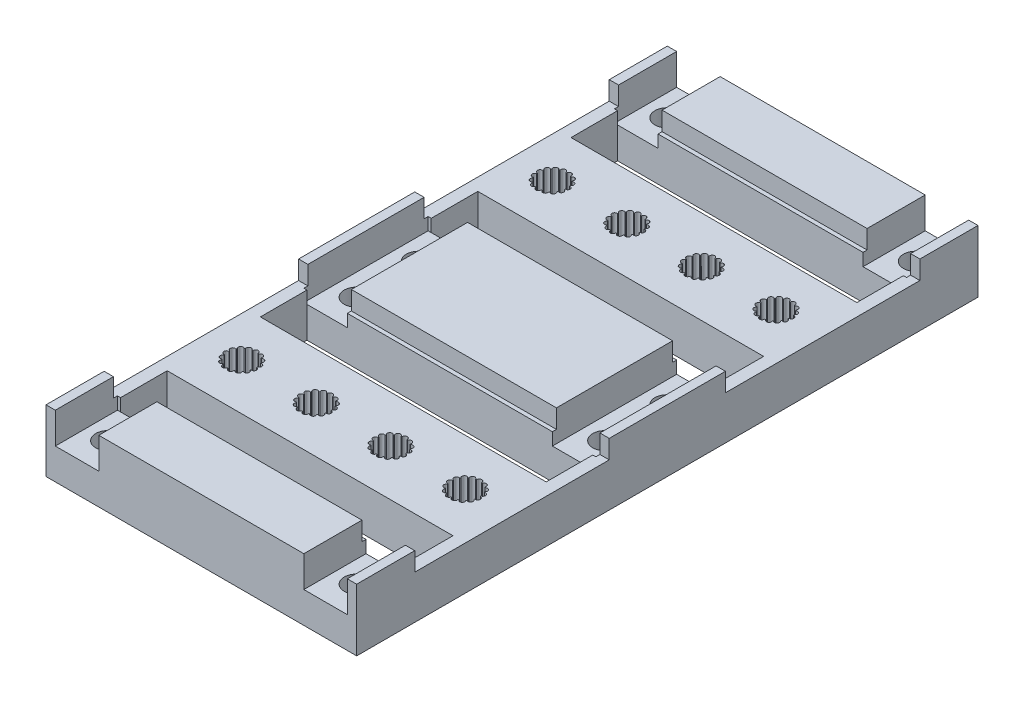
from build123d import *

# Parameters (mm, degrees)
SKETCH1_W                                  = 50
SKETCH1_H                                  = 50
BOSS_EXTRUDE2_DEPTH                        = 10
SKETCH2_W                                  = 50
SKETCH2_H                                  = 31.3
SKETCH2_W_2                                = 4.65
CUT_EXTRUDE1_DEPTH                         = 3
SKETCH3_R                                  = 2
CUT_EXTRUDE2_DEPTH                         = 34
SKETCH4_W                                  = 7
SKETCH4_H                                  = 10
CUT_EXTRUDE4_DEPTH                         = 5
MIRROR1_AT_THE_SECOND_PLANE_COPY_1_SKETC_W = 7
MIRROR1_AT_THE_SECOND_PLANE_COPY_1_SKETC_H = 10
MIRROR1_AT_THE_SECOND_PLANE_COPY_1_DEPTH   = 5
SKETCH6_W                                  = 46
SKETCH6_H                                  = 30
SKETCH6_W_2                                = 40
SKETCH6_H_2                                = 24
CUT_EXTRUDE5_DEPTH                         = 37.041642582
BOSS_EXTRUDE3_START                        = -10
BOSS_EXTRUDE3_OUTLINE_W                    = 46
BOSS_EXTRUDE3_OUTLINE_H                    = 15
BOSS_EXTRUDE3_DEPTH                        = 7


# Read off the part's stored shape, not the designer's step: Boss-Extrude3
with BuildPart() as part:
    # Sketch1 → Boss-Extrude2 (new body)
    with BuildSketch(Plane(origin=(0, 0, 0), x_dir=(1, 0, 0), z_dir=(0, 1, 0))):
        Rectangle(SKETCH1_W, SKETCH1_H)
    extrude(amount=BOSS_EXTRUDE2_DEPTH)

    # Sketch2 → Cut-Extrude1 (cut)
    with BuildSketch(Plane(origin=(0, 10, 0), x_dir=(1, 0, 0), z_dir=(0, 1, 0))):
        Rectangle(SKETCH2_W, SKETCH2_H)
        with Locations((-27.325, 0)):
            Rectangle(SKETCH2_W_2, SKETCH2_H)
        with Locations((27.325, 0)):
            Rectangle(SKETCH2_W_2, SKETCH2_H)
    extrude(amount=-CUT_EXTRUDE1_DEPTH, mode=Mode.SUBTRACT)

    # Sketch3 → Cut-Extrude2 (cut)
    with BuildSketch(Plane(origin=(0, 10, 0), x_dir=(1, 0, 0), z_dir=(0, 1, 0))):
        with Locations(Location((-20, 20, 0), (0, 0, 270))):
            Circle(SKETCH3_R)
        with Locations(Location((20, 20, 0), (0, 0, 270))):
            Circle(SKETCH3_R)
        with Locations(Location((20, -20, 0), (0, 0, 270))):
            Circle(SKETCH3_R)
        with Locations(Location((-20, -20, 0), (0, 0, 270))):
            Circle(SKETCH3_R)
    extrude(amount=-CUT_EXTRUDE2_DEPTH, mode=Mode.SUBTRACT)

    # Sketch4 → Cut-Extrude4 (cut)
    with BuildSketch(Plane(origin=(0, 10, 0), x_dir=(1, 0, 0), z_dir=(0, 1, 0))):
        with Locations((-20, 20)):
            Rectangle(SKETCH4_W, SKETCH4_H)
    cut_extrude4 = extrude(amount=-CUT_EXTRUDE4_DEPTH, mode=Mode.SUBTRACT)

    # Mirror1: Cut-Extrude4 across plane
    add(cut_extrude4.mirror(Plane.ZY), mode=Mode.SUBTRACT)

    # Mirror1 at the second plane: Cut-Extrude4 across plane
    add(cut_extrude4.mirror(Plane.XY), mode=Mode.SUBTRACT)

    # Mirror1 at the second plane copy 1 sketc → Mirror1 at the second plane copy 1 (cut)
    with BuildSketch(Plane(origin=(0, 10, 0), x_dir=(-1, 0, 0), z_dir=(0, 1, 0))):
        with Locations((-20, 20)):
            Rectangle(MIRROR1_AT_THE_SECOND_PLANE_COPY_1_SKETC_W, MIRROR1_AT_THE_SECOND_PLANE_COPY_1_SKETC_H)
    extrude(amount=-MIRROR1_AT_THE_SECOND_PLANE_COPY_1_DEPTH, mode=Mode.SUBTRACT)

    # Sketch6 → Cut-Extrude5 (cut, through all)
    # profile 1 of 2: a face of its own
    with BuildSketch(Plane(origin=(0, 7, 0), x_dir=(1, 0, 0), z_dir=(0, 1, 0))):
        Rectangle(SKETCH6_W, SKETCH6_H)
        Rectangle(SKETCH6_W_2, SKETCH6_H_2, mode=Mode.SUBTRACT)
    # profile 2 of 2: a face of its own
    with BuildSketch(Plane(origin=(0, 7, 0), x_dir=(1, 0, 0), z_dir=(0, 1, 0))):
        Rectangle(SKETCH6_W_2, SKETCH6_H_2)
    extrude(amount=-CUT_EXTRUDE5_DEPTH, mode=Mode.SUBTRACT)

    # Boss-Extrude3 outline → Boss-Extrude3 (add)
    with BuildSketch(Plane(origin=(0, 10, 0), x_dir=(1, 0, 0), z_dir=(0, 1, 0)).offset(BOSS_EXTRUDE3_START)):
        Rectangle(BOSS_EXTRUDE3_OUTLINE_W, BOSS_EXTRUDE3_OUTLINE_H)
        with BuildLine():
            ThreePointArc((-20.489629063, 1.063217688), (-20.455241909, 1.125), (-20.418930434, 1.185671305))
            ThreePointArc((-20.418930434, 1.185671305), (-20.476018538, 1.773196107), (-19.885744926, 1.777833803))
            ThreePointArc((-19.885744926, 1.777833803), (-19.829201567, 1.820288237), (-19.771352142, 1.860945025))
            ThreePointArc((-19.771352142, 1.860945025), (-19.584536854, 2.420895463), (-19.043408757, 2.185046302))
            ThreePointArc((-19.043408757, 2.185046302), (-18.974486054, 2.200832102), (-18.905101369, 2.214444444))
            ThreePointArc((-18.905101369, 2.214444444), (-18.50668475, 2.65), (-18.108268131, 2.214444444))
            ThreePointArc((-18.108268131, 2.214444444), (-18.038883446, 2.200832102), (-17.969960743, 2.185046302))
            ThreePointArc((-17.969960743, 2.185046302), (-17.428832646, 2.420895463), (-17.242017358, 1.860945025))
            ThreePointArc((-17.242017358, 1.860945025), (-17.184167933, 1.820288237), (-17.127624574, 1.777833803))
            ThreePointArc((-17.127624574, 1.777833803), (-16.537350963, 1.773196107), (-16.594439066, 1.185671305))
            ThreePointArc((-16.594439066, 1.185671305), (-16.558127592, 1.125), (-16.523740437, 1.063217688))
            ThreePointArc((-16.523740437, 1.063217688), (-15.986384982, 0.818895035), (-16.277505425, 0.305384245))
            ThreePointArc((-16.277505425, 0.305384245), (-16.269010486, 0.235189043), (-16.262725387, 0.164761577))
            ThreePointArc((-16.262725387, 0.164761577), (-15.871201727, -0.277000427), (-16.346017141, -0.627706526))
            ThreePointArc((-16.346017141, -0.627706526), (-16.366807588, -0.695288238), (-16.389711296, -0.762183309))
            ThreePointArc((-16.389711296, -0.762183309), (-16.21171743, -1.325000001), (-16.788127916, -1.452261136))
            ThreePointArc((-16.788127916, -1.452261136), (-16.834608893, -1.505543864), (-16.882741148, -1.557339776))
            ThreePointArc((-16.882741148, -1.557339776), (-16.949053832, -2.143895035), (-17.527392779, -2.025706602))
            ThreePointArc((-17.527392779, -2.025706602), (-17.591527303, -2.05547728), (-17.656565601, -2.083218047))
            ThreePointArc((-17.656565601, -2.083218047), (-17.955718769, -2.592091142), (-18.435986122, -2.248888993))
            ThreePointArc((-18.435986122, -2.248888993), (-18.50668475, -2.25), (-18.577383379, -2.248888993))
            ThreePointArc((-18.577383379, -2.248888993), (-19.057650731, -2.592091142), (-19.356803899, -2.083218047))
            ThreePointArc((-19.356803899, -2.083218047), (-19.421842197, -2.05547728), (-19.485976721, -2.025706602))
            ThreePointArc((-19.485976721, -2.025706602), (-20.064315669, -2.143895035), (-20.130628352, -1.557339776))
            ThreePointArc((-20.130628352, -1.557339776), (-20.178760607, -1.505543864), (-20.225241585, -1.452261136))
            ThreePointArc((-20.225241585, -1.452261136), (-20.80165207, -1.325), (-20.623658204, -0.762183309))
            ThreePointArc((-20.623658204, -0.762183309), (-20.646561912, -0.695288238), (-20.667352359, -0.627706526))
            ThreePointArc((-20.667352359, -0.627706526), (-21.142167773, -0.277000427), (-20.750644113, 0.164761577))
            ThreePointArc((-20.750644113, 0.164761577), (-20.744359015, 0.235189043), (-20.735864075, 0.305384245))
            ThreePointArc((-20.735864075, 0.305384245), (-21.026984518, 0.818895035), (-20.489629063, 1.063217688))
        make_face(mode=Mode.SUBTRACT)
        with BuildLine():
            ThreePointArc((-6.108268131, 2.214444444), (-6.038883446, 2.200832102), (-5.969960743, 2.185046302))
            ThreePointArc((-5.969960743, 2.185046302), (-5.428832646, 2.420895463), (-5.242017358, 1.860945025))
            ThreePointArc((-5.242017358, 1.860945025), (-5.184167933, 1.820288237), (-5.127624574, 1.777833803))
            ThreePointArc((-5.127624574, 1.777833803), (-4.537350963, 1.773196107), (-4.594439066, 1.185671305))
            ThreePointArc((-4.594439066, 1.185671305), (-4.558127592, 1.125), (-4.523740437, 1.063217688))
            ThreePointArc((-4.523740437, 1.063217688), (-3.986384982, 0.818895035), (-4.277505425, 0.305384245))
            ThreePointArc((-4.277505425, 0.305384245), (-4.269010486, 0.235189043), (-4.262725387, 0.164761577))
            ThreePointArc((-4.262725387, 0.164761577), (-3.871201727, -0.277000427), (-4.346017141, -0.627706526))
            ThreePointArc((-4.346017141, -0.627706526), (-4.366807588, -0.695288238), (-4.389711296, -0.762183309))
            ThreePointArc((-4.389711296, -0.762183309), (-4.21171743, -1.325000001), (-4.788127916, -1.452261136))
            ThreePointArc((-4.788127916, -1.452261136), (-4.834608893, -1.505543864), (-4.882741148, -1.557339776))
            ThreePointArc((-4.882741148, -1.557339776), (-4.949053832, -2.143895035), (-5.527392779, -2.025706602))
            ThreePointArc((-5.527392779, -2.025706602), (-5.591527303, -2.05547728), (-5.656565601, -2.083218047))
            ThreePointArc((-5.656565601, -2.083218047), (-5.955718769, -2.592091142), (-6.435986122, -2.248888993))
            ThreePointArc((-6.435986122, -2.248888993), (-6.50668475, -2.25), (-6.577383379, -2.248888993))
            ThreePointArc((-6.577383379, -2.248888993), (-7.057650731, -2.592091142), (-7.356803899, -2.083218047))
            ThreePointArc((-7.356803899, -2.083218047), (-7.421842197, -2.05547728), (-7.485976721, -2.025706602))
            ThreePointArc((-7.485976721, -2.025706602), (-8.064315669, -2.143895035), (-8.130628352, -1.557339776))
            ThreePointArc((-8.130628352, -1.557339776), (-8.178760607, -1.505543864), (-8.225241585, -1.452261136))
            ThreePointArc((-8.225241585, -1.452261136), (-8.80165207, -1.325), (-8.623658204, -0.762183309))
            ThreePointArc((-8.623658204, -0.762183309), (-8.646561912, -0.695288238), (-8.667352359, -0.627706526))
            ThreePointArc((-8.667352359, -0.627706526), (-9.142167773, -0.277000427), (-8.750644113, 0.164761577))
            ThreePointArc((-8.750644113, 0.164761577), (-8.744359015, 0.235189043), (-8.735864075, 0.305384245))
            ThreePointArc((-8.735864075, 0.305384245), (-9.026984518, 0.818895035), (-8.489629063, 1.063217688))
            ThreePointArc((-8.489629063, 1.063217688), (-8.455241909, 1.125), (-8.418930434, 1.185671305))
            ThreePointArc((-8.418930434, 1.185671305), (-8.476018538, 1.773196107), (-7.885744926, 1.777833803))
            ThreePointArc((-7.885744926, 1.777833803), (-7.829201567, 1.820288237), (-7.771352142, 1.860945025))
            ThreePointArc((-7.771352142, 1.860945025), (-7.584536854, 2.420895463), (-7.043408757, 2.185046302))
            ThreePointArc((-7.043408757, 2.185046302), (-6.974486054, 2.200832102), (-6.905101369, 2.214444444))
            ThreePointArc((-6.905101369, 2.214444444), (-6.50668475, 2.65), (-6.108268131, 2.214444444))
        make_face(mode=Mode.SUBTRACT)
        with BuildLine():
            ThreePointArc((5.891731869, 2.214444444), (5.961116554, 2.200832102), (6.030039257, 2.185046302))
            ThreePointArc((6.030039257, 2.185046302), (6.571167354, 2.420895463), (6.757982642, 1.860945025))
            ThreePointArc((6.757982642, 1.860945025), (6.815832067, 1.820288237), (6.872375426, 1.777833803))
            ThreePointArc((6.872375426, 1.777833803), (7.462649037, 1.773196107), (7.405560934, 1.185671305))
            ThreePointArc((7.405560934, 1.185671305), (7.441872408, 1.125), (7.476259563, 1.063217688))
            ThreePointArc((7.476259563, 1.063217688), (8.013615018, 0.818895035), (7.722494575, 0.305384245))
            ThreePointArc((7.722494575, 0.305384245), (7.730989514, 0.235189043), (7.737274613, 0.164761577))
            ThreePointArc((7.737274613, 0.164761577), (8.128798273, -0.277000427), (7.653982859, -0.627706526))
            ThreePointArc((7.653982859, -0.627706526), (7.633192412, -0.695288238), (7.610288704, -0.762183309))
            ThreePointArc((7.610288704, -0.762183309), (7.78828257, -1.325000001), (7.211872084, -1.452261136))
            ThreePointArc((7.211872084, -1.452261136), (7.165391107, -1.505543864), (7.117258852, -1.557339776))
            ThreePointArc((7.117258852, -1.557339776), (7.050946168, -2.143895035), (6.472607221, -2.025706602))
            ThreePointArc((6.472607221, -2.025706602), (6.408472697, -2.05547728), (6.343434399, -2.083218047))
            ThreePointArc((6.343434399, -2.083218047), (6.044281231, -2.592091142), (5.564013878, -2.248888993))
            ThreePointArc((5.564013878, -2.248888993), (5.49331525, -2.25), (5.422616621, -2.248888993))
            ThreePointArc((5.422616621, -2.248888993), (4.942349269, -2.592091142), (4.643196101, -2.083218047))
            ThreePointArc((4.643196101, -2.083218047), (4.578157803, -2.05547728), (4.514023279, -2.025706602))
            ThreePointArc((4.514023279, -2.025706602), (3.935684331, -2.143895035), (3.869371648, -1.557339776))
            ThreePointArc((3.869371648, -1.557339776), (3.821239393, -1.505543864), (3.774758415, -1.452261136))
            ThreePointArc((3.774758415, -1.452261136), (3.19834793, -1.325), (3.376341796, -0.762183309))
            ThreePointArc((3.376341796, -0.762183309), (3.353438088, -0.695288238), (3.332647641, -0.627706526))
            ThreePointArc((3.332647641, -0.627706526), (2.857832227, -0.277000427), (3.249355887, 0.164761577))
            ThreePointArc((3.249355887, 0.164761577), (3.255640985, 0.235189043), (3.264135925, 0.305384245))
            ThreePointArc((3.264135925, 0.305384245), (2.973015482, 0.818895035), (3.510370937, 1.063217688))
            ThreePointArc((3.510370937, 1.063217688), (3.544758091, 1.125), (3.581069566, 1.185671305))
            ThreePointArc((3.581069566, 1.185671305), (3.523981462, 1.773196107), (4.114255074, 1.777833803))
            ThreePointArc((4.114255074, 1.777833803), (4.170798433, 1.820288237), (4.228647858, 1.860945025))
            ThreePointArc((4.228647858, 1.860945025), (4.415463146, 2.420895463), (4.956591243, 2.185046302))
            ThreePointArc((4.956591243, 2.185046302), (5.025513946, 2.200832102), (5.094898631, 2.214444444))
            ThreePointArc((5.094898631, 2.214444444), (5.49331525, 2.65), (5.891731869, 2.214444444))
        make_face(mode=Mode.SUBTRACT)
        with BuildLine():
            ThreePointArc((17.891731869, 2.214444444), (17.961116554, 2.200832102), (18.030039257, 2.185046302))
            ThreePointArc((18.030039257, 2.185046302), (18.571167354, 2.420895463), (18.757982642, 1.860945025))
            ThreePointArc((18.757982642, 1.860945025), (18.815832067, 1.820288237), (18.872375426, 1.777833803))
            ThreePointArc((18.872375426, 1.777833803), (19.462649037, 1.773196107), (19.405560934, 1.185671305))
            ThreePointArc((19.405560934, 1.185671305), (19.441872408, 1.125), (19.476259563, 1.063217688))
            ThreePointArc((19.476259563, 1.063217688), (20.013615018, 0.818895035), (19.722494575, 0.305384245))
            ThreePointArc((19.722494575, 0.305384245), (19.730989514, 0.235189043), (19.737274613, 0.164761577))
            ThreePointArc((19.737274613, 0.164761577), (20.128798273, -0.277000427), (19.653982859, -0.627706526))
            ThreePointArc((19.653982859, -0.627706526), (19.633192412, -0.695288238), (19.610288704, -0.762183309))
            ThreePointArc((19.610288704, -0.762183309), (19.78828257, -1.325000001), (19.211872084, -1.452261136))
            ThreePointArc((19.211872084, -1.452261136), (19.165391107, -1.505543864), (19.117258852, -1.557339776))
            ThreePointArc((19.117258852, -1.557339776), (19.050946168, -2.143895035), (18.472607221, -2.025706602))
            ThreePointArc((18.472607221, -2.025706602), (18.408472697, -2.05547728), (18.343434399, -2.083218047))
            ThreePointArc((18.343434399, -2.083218047), (18.044281231, -2.592091142), (17.564013878, -2.248888993))
            ThreePointArc((17.564013878, -2.248888993), (17.49331525, -2.25), (17.422616621, -2.248888993))
            ThreePointArc((17.422616621, -2.248888993), (16.942349269, -2.592091142), (16.643196101, -2.083218047))
            ThreePointArc((16.643196101, -2.083218047), (16.578157803, -2.05547728), (16.514023279, -2.025706602))
            ThreePointArc((16.514023279, -2.025706602), (15.935684331, -2.143895035), (15.869371648, -1.557339776))
            ThreePointArc((15.869371648, -1.557339776), (15.821239393, -1.505543864), (15.774758415, -1.452261136))
            ThreePointArc((15.774758415, -1.452261136), (15.19834793, -1.325), (15.376341796, -0.762183309))
            ThreePointArc((15.376341796, -0.762183309), (15.353438088, -0.695288238), (15.332647641, -0.627706526))
            ThreePointArc((15.332647641, -0.627706526), (14.857832227, -0.277000427), (15.249355887, 0.164761577))
            ThreePointArc((15.249355887, 0.164761577), (15.255640985, 0.235189043), (15.264135925, 0.305384245))
            ThreePointArc((15.264135925, 0.305384245), (14.973015482, 0.818895035), (15.510370937, 1.063217688))
            ThreePointArc((15.510370937, 1.063217688), (15.544758091, 1.125), (15.581069566, 1.185671305))
            ThreePointArc((15.581069566, 1.185671305), (15.523981462, 1.773196107), (16.114255074, 1.777833803))
            ThreePointArc((16.114255074, 1.777833803), (16.170798433, 1.820288237), (16.228647858, 1.860945025))
            ThreePointArc((16.228647858, 1.860945025), (16.415463146, 2.420895463), (16.956591243, 2.185046302))
            ThreePointArc((16.956591243, 2.185046302), (17.025513946, 2.200832102), (17.094898631, 2.214444444))
            ThreePointArc((17.094898631, 2.214444444), (17.49331525, 2.65), (17.891731869, 2.214444444))
        make_face(mode=Mode.SUBTRACT)
    extrude(amount=BOSS_EXTRUDE3_DEPTH)

    # Mirror2: part across plane


with BuildPart() as part_1:
    add(part.part)
    add(part.part.mirror(Plane(origin=(-25, 10, -25), x_dir=(1, 0, 0), z_dir=(0, 0, -1))))


solid = part_1.part
